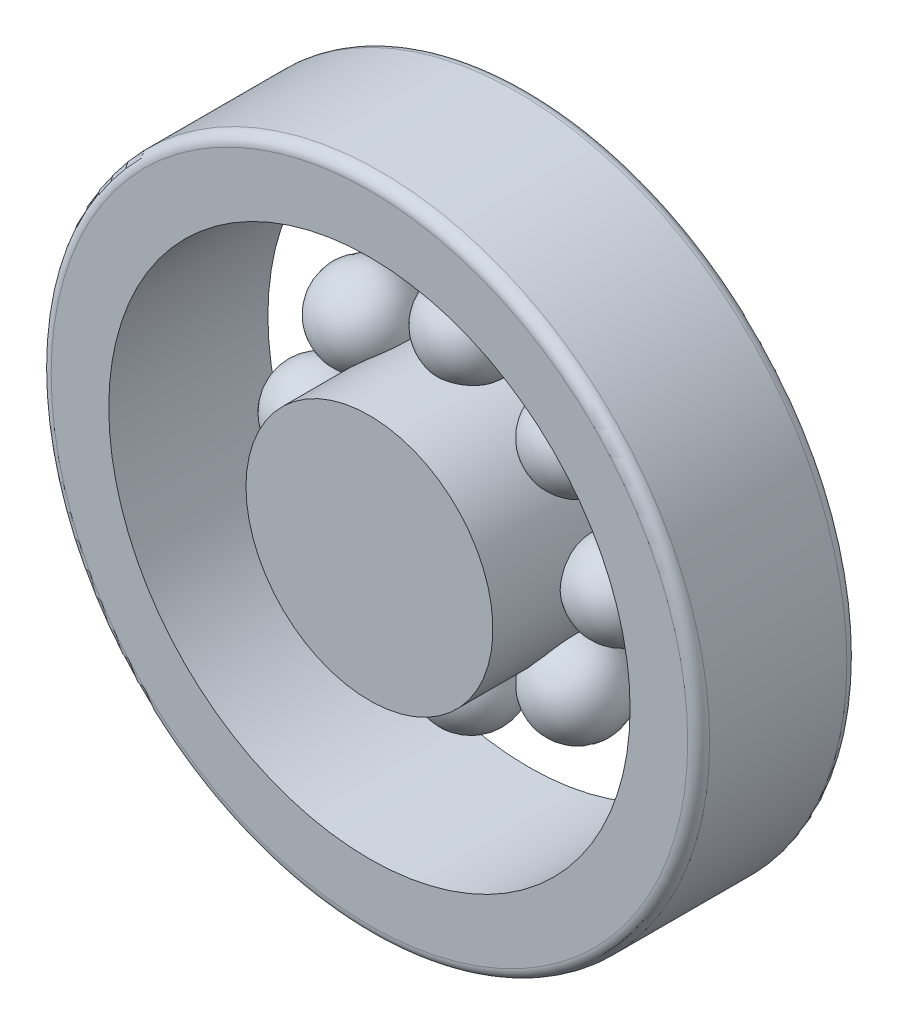
from build123d import *

# Parameters (mm, degrees)
SKETCH1_R             = 22.5
BOSS_EXTRUDE1_DEPTH   = 29
SKETCH1_R_2           = 60
SKETCH1_R_3           = 47.5
BOSS_EXTRUDE1_2_DEPTH = 29
CIRPATTERN1_COUNT     = 8
FILLET1_R             = 2


with BuildPart() as part:
    # Sketch1 → Boss-Extrude1 (new body)
    with BuildSketch(Plane.XY):
        Circle(SKETCH1_R)
    extrude(amount=BOSS_EXTRUDE1_DEPTH)


with BuildPart() as body_2:
    # Sketch1 → Boss-Extrude1 2 (new body)
    with BuildSketch(Plane.XY):
        Circle(SKETCH1_R_2)
        Circle(SKETCH1_R_3, mode=Mode.SUBTRACT)
    extrude(amount=BOSS_EXTRUDE1_2_DEPTH)

    # Fillet1
    fillet1_edges = [body_2.edges().sort_by_distance(p)[0] for p in [
        (-60, 0, 29),
        (-60, 0, 0),
    ]]
    fillet(fillet1_edges, radius=FILLET1_R)


with BuildPart() as body_3:
    # Sketch3 → Revolve1 (revolve)
    with BuildSketch(Plane(origin=(0, 0, 0), x_dir=(1, 0, 0), z_dir=(0, 1, 0))):
        with BuildLine():
            Line((27.5, -2.5), (27.5, -18.5))
            ThreePointArc((27.5, -18.5), (35.5, -10.5), (27.5, -2.5))
        make_face()
    revolve(axis=Axis((27.5, 0, 2.5), (0, 0, 1)))


with BuildPart() as cirpattern1_1:
    # CirPattern1: pattern copy
    add(body_3.part.rotate(Axis((0, 0, 0), (0, 0, -1)), 1 * 360 / CIRPATTERN1_COUNT))


with BuildPart() as cirpattern1_2:
    # CirPattern1: pattern copy
    add(body_3.part.rotate(Axis((0, 0, 0), (0, 0, -1)), 2 * 360 / CIRPATTERN1_COUNT))


with BuildPart() as cirpattern1_3:
    # CirPattern1: pattern copy
    add(body_3.part.rotate(Axis((0, 0, 0), (0, 0, -1)), 3 * 360 / CIRPATTERN1_COUNT))


with BuildPart() as cirpattern1_4:
    # CirPattern1: pattern copy
    add(body_3.part.rotate(Axis((0, 0, 0), (0, 0, -1)), 4 * 360 / CIRPATTERN1_COUNT))


with BuildPart() as cirpattern1_5:
    # CirPattern1: pattern copy
    add(body_3.part.rotate(Axis((0, 0, 0), (0, 0, -1)), 5 * 360 / CIRPATTERN1_COUNT))


with BuildPart() as cirpattern1_6:
    # CirPattern1: pattern copy
    add(body_3.part.rotate(Axis((0, 0, 0), (0, 0, -1)), 6 * 360 / CIRPATTERN1_COUNT))


with BuildPart() as cirpattern1_7:
    # CirPattern1: pattern copy
    add(body_3.part.rotate(Axis((0, 0, 0), (0, 0, -1)), 7 * 360 / CIRPATTERN1_COUNT))


solid = Compound([part.part, body_2.part, body_3.part, cirpattern1_1.part, cirpattern1_2.part, cirpattern1_3.part, cirpattern1_4.part, cirpattern1_5.part, cirpattern1_6.part, cirpattern1_7.part])
